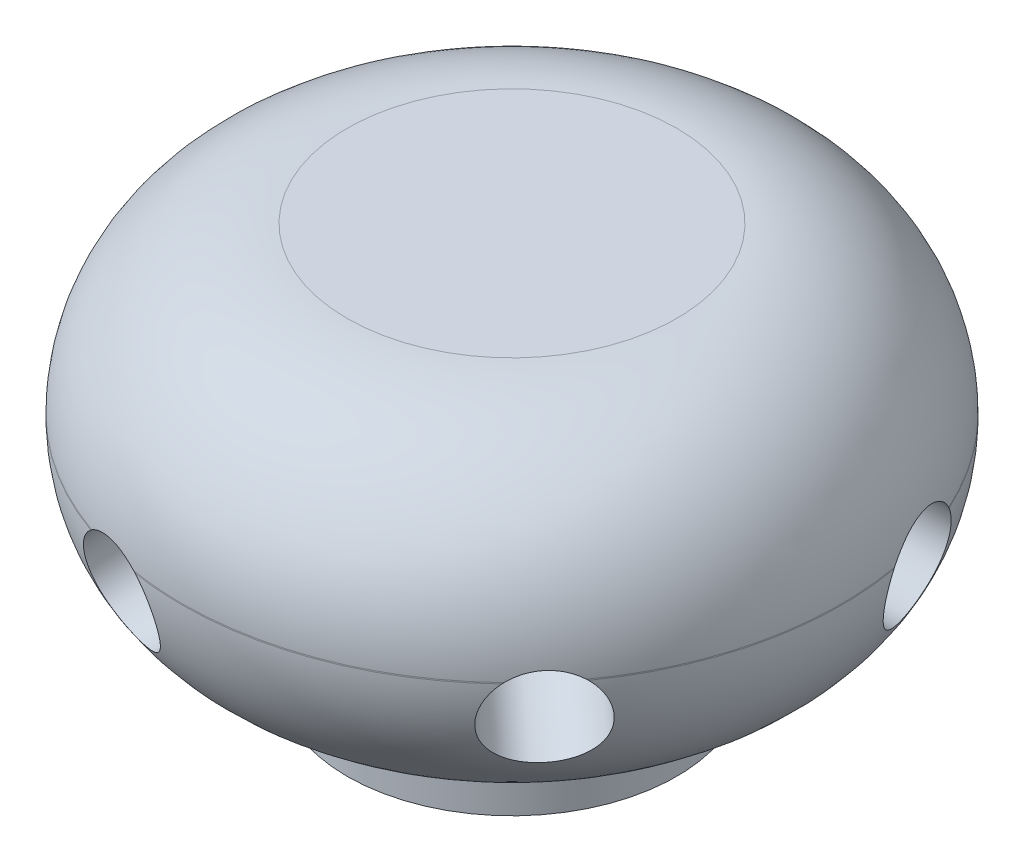
from build123d import *

# Parameters (mm, degrees)
BASE_DEPTH          = 3.035432218
BASE_DEPTH_BACK     = 7
SKETCH1_R           = 10
SKETCH3_R           = 1.5
HOLE2_DEPTH         = 19.445737436
HOLE2MIRROR_COUNT   = 2
SKETCH4_R           = 1.5
HOLE3_DEPTH         = 19.389503466
SKETCH5_R           = 1.5
CUT_EXTRUDE1_DEPTH  = 19.60459576
SKETCH6_R           = 1.5
CUT_EXTRUDE2_DEPTH  = 19.841947755
SKETCH7_R           = 1.5
CUT_EXTRUDE3_DEPTH  = 19.934353442
FILLET1_R           = 5
SKETCH8_R           = 5
BOSS_EXTRUDE1_DEPTH = 2


with BuildPart() as part:
    # Sketch1 → base (new, two sides: drawn at the far end of the back side and taken through both)
    with BuildSketch(Plane(origin=(0, 0, 0), x_dir=(1, 0, 0), z_dir=(0, 1, 0)).offset(-BASE_DEPTH_BACK)):
        with Locations(Location((0, 0, 0), (0, 0, 270))):
            Circle(SKETCH1_R)
    extrude(amount=BASE_DEPTH + BASE_DEPTH_BACK)

    # Sketch3 → hole2 (cut, through all)
    with BuildSketch(Plane(origin=(-0.941672921, -1.236067977, 3.685836142), x_dir=(-0.9718935871364875, 0.07382318789513377, -0.22354639834264944), z_dir=(0.23541823021467095, 0.3090169943749464, -0.921459035481267))):
        with Locations(Location((0, 0, 0), (0, 0, 90.062171088))):
            Circle(SKETCH3_R)
    hole2 = extrude(amount=-HOLE2_DEPTH, mode=Mode.SUBTRACT)

    # hole2mirror: hole2 ×2 about axis
    hole2mirror_axis = Axis((0, 5.5, 0), (0, -1, 0))
    for i in range(1, HOLE2MIRROR_COUNT):
        add(hole2.rotate(hole2mirror_axis, i * 360 / HOLE2MIRROR_COUNT), mode=Mode.SUBTRACT)

    # Sketch4 → hole3 (cut, through all)
    with BuildSketch(Plane(origin=(-3.717841, -1.236067977, 0.806098168), x_dir=(-0.19123247894507908, -0.06357892752956036, -0.979483465389136), z_dir=(0.9294602499075393, 0.30901699437494623, -0.20152454200243008))):
        with Locations(Location((0, 0, 0), (0, 0, 90))):
            Circle(SKETCH4_R)
    extrude(amount=-HOLE3_DEPTH, mode=Mode.SUBTRACT)

    # Sketch5 → Cut-Extrude1 (cut, through all)
    with BuildSketch(Plane(origin=(3.671965021, -1.093066116, -1.149730122), x_dir=(0.2754858058396647, -0.08200628219437099, 0.9578008876909271), z_dir=(-0.9179912552075574, 0.27326652891267317, 0.2874325304110031))):
        with Locations(Location((0, 0, 0), (0, 0, 4.890463))):
            Circle(SKETCH5_R)
    extrude(amount=-CUT_EXTRUDE1_DEPTH, mode=Mode.SUBTRACT)

    # Sketch6 → Cut-Extrude2 (cut, through all)
    with BuildSketch(Plane(origin=(2.875583134, -1.236067977, 2.490613899), x_dir=(-0.5720437997755544, 0.24589274231852376, 0.782497699941298), z_dir=(-0.7188957835464718, 0.30901699437494723, -0.6226534747245682))):
        with Locations(Location((0, 0, 0), (0, 0, 345.016140445))):
            Circle(SKETCH6_R)
    extrude(amount=-CUT_EXTRUDE2_DEPTH, mode=Mode.SUBTRACT)

    # Sketch7 → Cut-Extrude3 (cut, through all)
    with BuildSketch(Plane(origin=(-2.670502563, -1.093066116, -2.770130417), x_dir=(0.7444971483747472, -0.2450509606833859, -0.6210265877802813), z_dir=(0.6676256406564008, 0.2732665289126714, 0.6925326043690294))):
        with Locations(Location((0, 0, 0), (0, 0, 14.758597305))):
            Circle(SKETCH7_R)
    extrude(amount=-CUT_EXTRUDE3_DEPTH, mode=Mode.SUBTRACT)

    # Fillet1
    # the kernel refuses this fillet: 5 mm, written as the material it takes off along each edge
    with BuildSketch(Plane(origin=(0, 3.035432218, 0), x_dir=(0, 0, 1), z_dir=(-1, 0, 0))) as fillet1_piece_1:
        with BuildLine():
            CenterArc((10 - FILLET1_R, -FILLET1_R), FILLET1_R, 0, 90)
            Line((10 - FILLET1_R, 0), (10, 0))
            Line((10, 0), (10, -FILLET1_R))
        make_face()
    revolve(axis=Axis((0, 3.035432218, 0), (0, 1, 0)), mode=Mode.SUBTRACT)
    with BuildSketch(Plane(origin=(0, -7, 0), x_dir=(0, 0, 1), z_dir=(-1, 0, 0))) as fillet1_piece_2:
        with BuildLine():
            CenterArc((10 - FILLET1_R, FILLET1_R), FILLET1_R, 270, 90)
            Line((10 - FILLET1_R, 0), (10, 0))
            Line((10, 0), (10, FILLET1_R))
        make_face()
    revolve(axis=Axis((0, -7, 0), (0, 1, 0)), mode=Mode.SUBTRACT)

    # Sketch8 → Boss-Extrude1 (add)
    with BuildSketch(Plane.XZ.offset(7)):
        with Locations(Location((0, 0, 0), (0, 0, 90))):
            Circle(SKETCH8_R)
    extrude(amount=BOSS_EXTRUDE1_DEPTH)


solid = part.part
